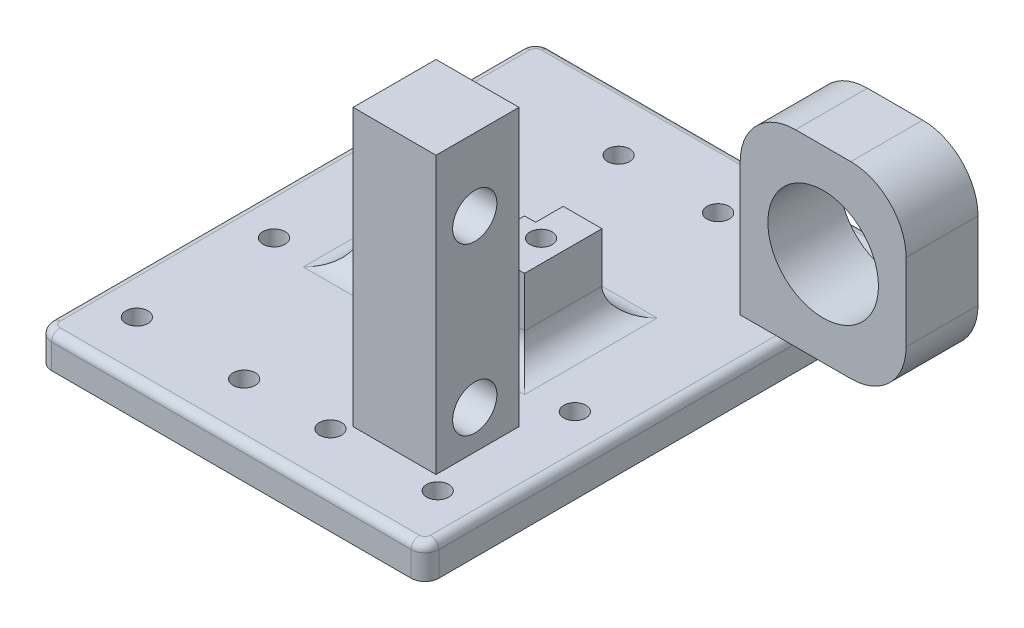
from build123d import *

# Parameters (mm, degrees)
SKETCH1_W           = 70
SKETCH1_H           = 90
SKETCH1_R           = 2
BOSS_EXTRUDE1_DEPTH = 6
SKETCH3_W           = 15
SKETCH3_H           = 7
BOSS_EXTRUDE2_DEPTH = 14
FILLET1_R           = 2.5
FILLET2_R           = 1.5
CUT_EXTRUDE1_DEPTH  = 22
SKETCH5_R           = 6
CUT_EXTRUDE2_DEPTH  = 22
CUT_EXTRUDE4_DEPTH  = 5
CUT_EXTRUDE5_START  = -5
SKETCH9_R           = 8
SKETCH9_R_2         = 6
CUT_EXTRUDE5_DEPTH  = 5
FILLET3_R           = 5
SKETCH10_W          = 30
SKETCH10_H          = 13
BOSS_EXTRUDE5_DEPTH = 34
CUT_EXTRUDE6_DEPTH  = 34
FILLET5_R           = 10
SKETCH14_W          = 15
SKETCH14_H          = 15
BOSS_EXTRUDE6_DEPTH = 50
SKETCH15_R          = 4
CUT_EXTRUDE7_DEPTH  = 10
SKETCH17_R          = 2.5
CUT_EXTRUDE8_DEPTH  = 30


with BuildPart() as part:
    # Sketch1 → Boss-Extrude1 (new body)
    with BuildSketch(Plane(origin=(0, 0, 0), x_dir=(1, 0, 0), z_dir=(0, 1, 0))):
        with Locations((26.984435798, -1.40077821)):
            Rectangle(SKETCH1_W, SKETCH1_H)
        with Locations(Location((17.984435798, 32.59922179, 0), (0, 0, 270))):
            Circle(SKETCH1_R, mode=Mode.SUBTRACT)
        with Locations(Location((18.095011811, 8.59922179, 0), (0, 0, 270))):
            Circle(SKETCH1_R, mode=Mode.SUBTRACT)
        with Locations(Location((35.873859784, 8.59922179, 0), (0, 0, 270))):
            Circle(SKETCH1_R, mode=Mode.SUBTRACT)
        with Locations(Location((35.984435798, 32.59922179, 0), (0, 0, 270))):
            Circle(SKETCH1_R, mode=Mode.SUBTRACT)
        with Locations(Location((19.184435798, -11.50077821, 0), (0, 0, 270))):
            Circle(SKETCH1_R, mode=Mode.SUBTRACT)
        with Locations(Location((-0.215564202, -11.50077821, 0), (0, 0, 270))):
            Circle(SKETCH1_R, mode=Mode.SUBTRACT)
        with Locations(Location((-0.215564202, -36.30077821, 0), (0, 0, 270))):
            Circle(SKETCH1_R, mode=Mode.SUBTRACT)
        with Locations(Location((19.184435798, -36.30077821, 0), (0, 0, 270))):
            Circle(SKETCH1_R, mode=Mode.SUBTRACT)
        with Locations(Location((54.184435798, -36.30077821, 0), (0, 0, 270))):
            Circle(SKETCH1_R, mode=Mode.SUBTRACT)
        with Locations(Location((34.784435798, -36.30077821, 0), (0, 0, 90))):
            Circle(SKETCH1_R, mode=Mode.SUBTRACT)
        with Locations(Location((34.784435798, -11.50077821, 0), (0, 0, 270))):
            Circle(SKETCH1_R, mode=Mode.SUBTRACT)
        with Locations(Location((54.184435798, -11.50077821, 0), (0, 0, 270))):
            Circle(SKETCH1_R, mode=Mode.SUBTRACT)
    extrude(amount=BOSS_EXTRUDE1_DEPTH)

    # Sketch3 → Boss-Extrude2 (add)
    with BuildSketch(Plane(origin=(0, 6, 0), x_dir=(1, 0, 0), z_dir=(0, 1, 0))):
        with Locations((19.484435798, 2.09922179)):
            Rectangle(SKETCH3_W, SKETCH3_H)
        with Locations((34.484435798, 2.09922179)):
            Rectangle(SKETCH3_W, SKETCH3_H)
        with Locations((34.484435798, -4.90077821)):
            Rectangle(SKETCH3_W, SKETCH3_H)
        with Locations((19.484435798, -4.90077821)):
            Rectangle(SKETCH3_W, SKETCH3_H)
    extrude(amount=BOSS_EXTRUDE2_DEPTH)

    # Fillet1
    fillet1_edges = [part.edges().sort_by_distance(p)[0] for p in [
        (-8.015564202, 3, 46.40077821),
        (-8.015564202, 3, -43.59922179),
        (61.984435798, 3, -43.59922179),
        (61.984435798, 3, 46.40077821),
    ]]
    fillet(fillet1_edges, radius=FILLET1_R)

    # Fillet2
    fillet2_edges = [part.edges().sort_by_distance(p)[0] for p in [
        (-8.015564202, 6, 1.40077821),
        (26.984435798, 6, -43.59922179),
        (26.984435798, 6, 46.40077821),
        (61.984435798, 6, 1.40077821),
        (-7.283331155, 6, 45.668545163),
        (61.252202751, 6, 45.668545163),
        (61.252202751, 6, -42.866988743),
        (-7.283331155, 6, -42.866988743),
    ]]
    fillet(fillet2_edges, radius=FILLET2_R)

    # Sketch4 → Cut-Extrude1 (cut)
    with BuildSketch(Plane(origin=(0, 20, 0), x_dir=(1, 0, 0), z_dir=(0, 1, 0))):
        with BuildLine():
            ThreePointArc((17.984435798, -1.40077821), (15.984435798, 0.59922179), (13.984435798, -1.40077821))
            Line((13.984435798, -1.40077821), (17.984435798, -1.40077821))
        make_face()
        with BuildLine():
            Line((17.984435798, -1.40077821), (13.984435798, -1.40077821))
            ThreePointArc((13.984435798, -1.40077821), (15.984435798, -3.40077821), (17.984435798, -1.40077821))
        make_face()
        with BuildLine():
            ThreePointArc((39.984435798, -1.40077821), (37.984435798, 0.59922179), (35.984435798, -1.40077821))
            Line((35.984435798, -1.40077821), (39.984435798, -1.40077821))
        make_face()
        with BuildLine():
            Line((39.984435798, -1.40077821), (35.984435798, -1.40077821))
            ThreePointArc((35.984435798, -1.40077821), (37.984435798, -3.40077821), (39.984435798, -1.40077821))
        make_face()
    extrude(amount=-CUT_EXTRUDE1_DEPTH, mode=Mode.SUBTRACT)

    # Sketch5 → Cut-Extrude2 (cut)
    with BuildSketch(Plane(origin=(0, 0, -5.59922179), x_dir=(-1, 0, 0), z_dir=(0, 0, -1))):
        with Locations((-26.984435798, 20)):
            Circle(SKETCH5_R)
    extrude(amount=-CUT_EXTRUDE2_DEPTH, mode=Mode.SUBTRACT)

    # Sketch6 → Cut-Extrude4 (cut)
    with BuildSketch(Plane(origin=(0, 0, -5.59922179), x_dir=(-1, 0, 0), z_dir=(0, 0, -1))):
        with BuildLine():
            ThreePointArc((-34.984435798, 20), (-26.984435798, 12), (-18.984435798, 20))
            Line((-18.984435798, 20), (-20.984435798, 20))
            ThreePointArc((-20.984435798, 20), (-26.984435798, 14), (-32.984435798, 20))
            Line((-32.984435798, 20), (-34.984435798, 20))
        make_face()
    extrude(amount=-CUT_EXTRUDE4_DEPTH, mode=Mode.SUBTRACT)

    # Sketch9 → Cut-Extrude5 (cut)
    with BuildSketch(Plane.XY.offset(8.40077821).offset(CUT_EXTRUDE5_START)):
        with Locations((26.984435798, 20)):
            Circle(SKETCH9_R)
        with Locations((26.984435798, 20)):
            Circle(SKETCH9_R_2, mode=Mode.SUBTRACT)
    extrude(amount=CUT_EXTRUDE5_DEPTH, mode=Mode.SUBTRACT)

    # Fillet3
    # the kernel refuses this fillet: 5 mm, written as the material it adds along each edge
    with BuildSketch(Plane(origin=(41.984435798, 6, 8.40077821), x_dir=(0, 0, 1), z_dir=(-1, 0, 0))) as fillet3_piece_1_section:
        with BuildLine():
            CenterArc((FILLET3_R, FILLET3_R), FILLET3_R, 180, 90)
            Line((0, FILLET3_R), (0, 0))
            Line((0, 0), (FILLET3_R, 0))
        make_face()
    fillet3_piece_1 = extrude(amount=30, mode=Mode.PRIVATE)
    fillet3_piece_1 = fillet3_piece_1 - Plane(origin=(34.784435798, 7.197458463, 11.50077821), x_dir=(0, 0, 1), z_dir=(0, -1, 0)) * Cylinder(2, 80, mode=Mode.PRIVATE)
    fillet3_piece_1 = fillet3_piece_1 - Plane(origin=(19.184435798, 7.197458463, 11.50077821), x_dir=(0, 0, 1), z_dir=(0, -1, 0)) * Cylinder(2, 80, mode=Mode.PRIVATE)
    add(fillet3_piece_1)
    with BuildSketch(Plane(origin=(11.984435798, 6, -5.59922179), x_dir=(-1, 0, 0), z_dir=(0, 0, 1))) as fillet3_piece_2:
        with BuildLine():
            CenterArc((FILLET3_R, -FILLET3_R), FILLET3_R, 90, 90)
            Line((0, -FILLET3_R), (0, 0))
            Line((0, 0), (FILLET3_R, 0))
        make_face()
    extrude(amount=14)
    with BuildSketch(Plane(origin=(41.984435798, 6, -5.59922179), x_dir=(0, 0, -1), z_dir=(-1, 0, 0))) as fillet3_piece_3_section:
        with BuildLine():
            CenterArc((FILLET3_R, -FILLET3_R), FILLET3_R, 90, 90)
            Line((0, -FILLET3_R), (0, 0))
            Line((0, 0), (FILLET3_R, 0))
        make_face()
    fillet3_piece_3 = extrude(amount=30, mode=Mode.PRIVATE)
    fillet3_piece_3 = fillet3_piece_3 - Plane(origin=(35.873859784, 7.200103182, -8.59922179), x_dir=(0, 0, 1), z_dir=(0, -1, 0)) * Cylinder(2, 80, mode=Mode.PRIVATE)
    fillet3_piece_3 = fillet3_piece_3 - Plane(origin=(18.095011811, 7.200103182, -8.59922179), x_dir=(0, 0, 1), z_dir=(0, -1, 0)) * Cylinder(2, 80, mode=Mode.PRIVATE)
    add(fillet3_piece_3)
    with BuildSketch(Plane(origin=(41.984435798, 6, -5.59922179), x_dir=(1, 0, 0), z_dir=(0, 0, 1))) as fillet3_piece_4:
        with BuildLine():
            CenterArc((FILLET3_R, FILLET3_R), FILLET3_R, 180, 90)
            Line((0, FILLET3_R), (0, 0))
            Line((0, 0), (FILLET3_R, 0))
        make_face()
    extrude(amount=14)
    with BuildSketch(Plane(origin=(41.984435798, 6, -5.59922179), x_dir=(1, 0, 0), z_dir=(0, 0, 1))) as fillet3_piece_5a_section:
        with BuildLine():
            CenterArc((FILLET3_R, FILLET3_R), FILLET3_R, 180, 90)
            Line((0, FILLET3_R), (0, 0))
            Line((0, 0), (FILLET3_R, 0))
        make_face()
    fillet3_piece_5a = extrude(amount=26.5, mode=Mode.PRIVATE)
    fillet3_piece_5a = split(fillet3_piece_5a, bisect_by=Plane(origin=(43.116411369, 7.131975571, 8.40077821), z_dir=(0, 0, 1)), keep=Keep.TOP, mode=Mode.PRIVATE)
    with BuildSketch(Plane(origin=(54.484435798, 6, 8.40077821), x_dir=(0, 0, 1), z_dir=(-1, 0, 0))) as fillet3_piece_5b_section:
        with BuildLine():
            CenterArc((FILLET3_R, FILLET3_R), FILLET3_R, 180, 90)
            Line((0, FILLET3_R), (0, 0))
            Line((0, 0), (FILLET3_R, 0))
        make_face()
    fillet3_piece_5b = extrude(amount=42.5, mode=Mode.PRIVATE)
    fillet3_piece_5b = fillet3_piece_5b - Plane(origin=(54.184435798, 7.177432689, 11.50077821), x_dir=(0, 0, 1), z_dir=(0, -1, 0)) * Cylinder(2, 105, mode=Mode.PRIVATE)
    fillet3_piece_5b = split(fillet3_piece_5b, bisect_by=Plane(origin=(41.984435798, 7.177432689, 9.458456652), z_dir=(1, 0, 0)), keep=Keep.TOP, mode=Mode.PRIVATE)
    fillet3_piece_5 = fillet3_piece_5a & fillet3_piece_5b
    add(fillet3_piece_5)
    with BuildSketch(Plane(origin=(41.984435798, 6, 8.40077821), x_dir=(0, 0, 1), z_dir=(-1, 0, 0))) as fillet3_piece_6a_section:
        with BuildLine():
            CenterArc((FILLET3_R, FILLET3_R), FILLET3_R, 180, 90)
            Line((0, FILLET3_R), (0, 0))
            Line((0, 0), (FILLET3_R, 0))
        make_face()
    fillet3_piece_6a = extrude(amount=42.5, mode=Mode.PRIVATE)
    fillet3_piece_6a = fillet3_piece_6a - Plane(origin=(-0.215564202, 7.17743263, 11.50077821), x_dir=(0, 0, 1), z_dir=(0, -1, 0)) * Cylinder(2, 105, mode=Mode.PRIVATE)
    fillet3_piece_6a = split(fillet3_piece_6a, bisect_by=Plane(origin=(11.984435798, 7.17743263, 9.458456401), z_dir=(-1, 0, 0)), keep=Keep.TOP, mode=Mode.PRIVATE)
    with BuildSketch(Plane(origin=(11.984435798, 6, -5.59922179), x_dir=(-1, 0, 0), z_dir=(0, 0, 1))) as fillet3_piece_6b_section:
        with BuildLine():
            CenterArc((FILLET3_R, -FILLET3_R), FILLET3_R, 90, 90)
            Line((0, -FILLET3_R), (0, 0))
            Line((0, 0), (FILLET3_R, 0))
        make_face()
    fillet3_piece_6b = extrude(amount=26.5, mode=Mode.PRIVATE)
    fillet3_piece_6b = split(fillet3_piece_6b, bisect_by=Plane(origin=(10.852460226, 7.131975571, 8.40077821), z_dir=(0, 0, 1)), keep=Keep.TOP, mode=Mode.PRIVATE)
    fillet3_piece_6 = fillet3_piece_6a & fillet3_piece_6b
    add(fillet3_piece_6)
    with BuildSketch(Plane(origin=(11.984435798, 6, -18.09922179), x_dir=(-1, 0, 0), z_dir=(0, 0, 1))) as fillet3_piece_7a_section:
        with BuildLine():
            CenterArc((FILLET3_R, -FILLET3_R), FILLET3_R, 90, 90)
            Line((0, -FILLET3_R), (0, 0))
            Line((0, 0), (FILLET3_R, 0))
        make_face()
    fillet3_piece_7a = extrude(amount=26.5, mode=Mode.PRIVATE)
    fillet3_piece_7a = split(fillet3_piece_7a, bisect_by=Plane(origin=(10.852460226, 7.131975571, -5.59922179), z_dir=(0, 0, -1)), keep=Keep.TOP, mode=Mode.PRIVATE)
    with BuildSketch(Plane(origin=(41.984435798, 6, -5.59922179), x_dir=(0, 0, -1), z_dir=(-1, 0, 0))) as fillet3_piece_7b_section:
        with BuildLine():
            CenterArc((FILLET3_R, -FILLET3_R), FILLET3_R, 90, 90)
            Line((0, -FILLET3_R), (0, 0))
            Line((0, 0), (FILLET3_R, 0))
        make_face()
    fillet3_piece_7b = extrude(amount=42.5, mode=Mode.PRIVATE)
    fillet3_piece_7b = split(fillet3_piece_7b, bisect_by=Plane(origin=(11.984435798, 7.131975571, -6.731197361), z_dir=(-1, 0, 0)), keep=Keep.TOP, mode=Mode.PRIVATE)
    fillet3_piece_7 = fillet3_piece_7a & fillet3_piece_7b
    add(fillet3_piece_7)
    with BuildSketch(Plane(origin=(41.984435798, 6, -18.09922179), x_dir=(1, 0, 0), z_dir=(0, 0, 1))) as fillet3_piece_8a_section:
        with BuildLine():
            CenterArc((FILLET3_R, FILLET3_R), FILLET3_R, 180, 90)
            Line((0, FILLET3_R), (0, 0))
            Line((0, 0), (FILLET3_R, 0))
        make_face()
    fillet3_piece_8a = extrude(amount=26.5, mode=Mode.PRIVATE)
    fillet3_piece_8a = split(fillet3_piece_8a, bisect_by=Plane(origin=(43.116411369, 7.131975571, -5.59922179), z_dir=(0, 0, -1)), keep=Keep.TOP, mode=Mode.PRIVATE)
    with BuildSketch(Plane(origin=(54.484435798, 6, -5.59922179), x_dir=(0, 0, -1), z_dir=(-1, 0, 0))) as fillet3_piece_8b_section:
        with BuildLine():
            CenterArc((FILLET3_R, -FILLET3_R), FILLET3_R, 90, 90)
            Line((0, -FILLET3_R), (0, 0))
            Line((0, 0), (FILLET3_R, 0))
        make_face()
    fillet3_piece_8b = extrude(amount=42.5, mode=Mode.PRIVATE)
    fillet3_piece_8b = split(fillet3_piece_8b, bisect_by=Plane(origin=(41.984435798, 7.131975571, -6.731197361), z_dir=(1, 0, 0)), keep=Keep.TOP, mode=Mode.PRIVATE)
    fillet3_piece_8 = fillet3_piece_8a & fillet3_piece_8b
    add(fillet3_piece_8)

    # Sketch10 → Boss-Extrude5 (add)
    with BuildSketch(Plane(origin=(0, 6, 0), x_dir=(1, 0, 0), z_dir=(0, 1, 0))):
        with Locations((68.984435798, 25.09922179)):
            Rectangle(SKETCH10_W, SKETCH10_H)
    extrude(amount=BOSS_EXTRUDE5_DEPTH)

    # Sketch13 → Cut-Extrude6 (cut)
    with BuildSketch(Plane.XY.offset(-18.59922179)):
        with BuildLine():
            ThreePointArc((78.984435798, 23), (76.05550361, 30.071067812), (68.984435798, 33))
            Line((68.984435798, 33), (68.984435798, 23))
            Line((68.984435798, 23), (78.984435798, 23))
        make_face()
        with BuildLine():
            Line((68.984435798, 23), (68.984435798, 33))
            ThreePointArc((68.984435798, 33), (61.913367986, 30.071067812), (58.984435798, 23))
            Line((58.984435798, 23), (68.984435798, 23))
        make_face()
        with BuildLine():
            Line((78.984435798, 23), (68.984435798, 23))
            Line((68.984435798, 23), (68.984435798, 13))
            ThreePointArc((68.984435798, 13), (76.05550361, 15.928932188), (78.984435798, 23))
        make_face()
        with BuildLine():
            Line((68.984435798, 13), (68.984435798, 23))
            Line((68.984435798, 23), (58.984435798, 23))
            ThreePointArc((58.984435798, 23), (61.913367986, 15.928932188), (68.984435798, 13))
        make_face()
    extrude(amount=-CUT_EXTRUDE6_DEPTH, mode=Mode.SUBTRACT)

    # Fillet5
    fillet5_edges = [part.edges().sort_by_distance(p)[0] for p in [
        (83.984435798, 6, -25.09922179),
        (83.984435798, 40, -25.09922179),
        (53.984435798, 40, -25.09922179),
    ]]
    fillet(fillet5_edges, radius=FILLET5_R)

    # Sketch14 → Boss-Extrude6 (add)
    with BuildSketch(Plane(origin=(0, 6, 0), x_dir=(1, 0, 0), z_dir=(0, 1, 0))):
        with Locations((43.984435798, -26.40077821)):
            Rectangle(SKETCH14_W, SKETCH14_H)
    extrude(amount=BOSS_EXTRUDE6_DEPTH)

    # Sketch15 → Cut-Extrude7 (cut)
    with BuildSketch(Plane(origin=(51.484435798, 0, 0), x_dir=(0, 0, -1), z_dir=(1, 0, 0))):
        with Locations((-26.90077821, 13)):
            Circle(SKETCH15_R)
        with Locations((-26.90077821, 43)):
            Circle(SKETCH15_R)
    extrude(amount=-CUT_EXTRUDE7_DEPTH, mode=Mode.SUBTRACT)

    # Sketch17 → Cut-Extrude8 (cut)
    with BuildSketch(Plane(origin=(51.484435798, 0, 0), x_dir=(0, 0, -1), z_dir=(1, 0, 0))):
        with Locations((-26.90077821, 43)):
            Circle(SKETCH17_R)
        with Locations((-26.90077821, 13)):
            Circle(SKETCH17_R)
    extrude(amount=-CUT_EXTRUDE8_DEPTH, mode=Mode.SUBTRACT)


solid = part.part
